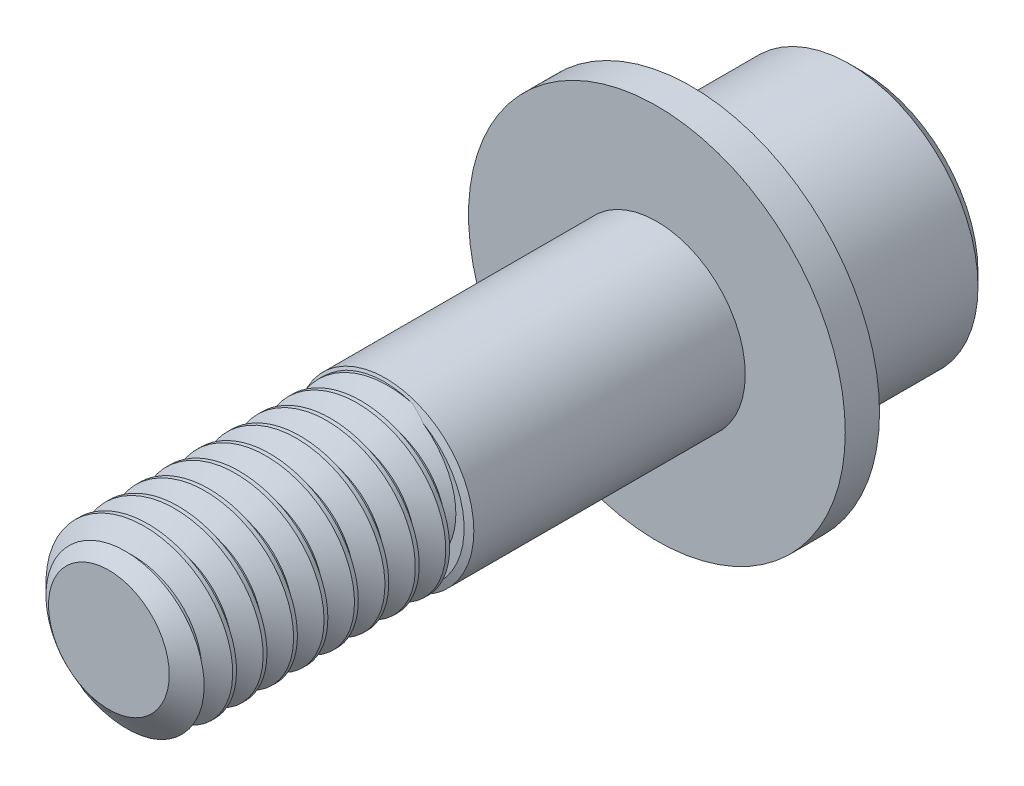
from build123d import *

# Parameters (mm, degrees)
SKETCH1_R           = 3.96875
EXTRUDE1_DEPTH      = 25.4
CUT_SWEEP1_PITCH    = 1.411111111
SKETCH6_R           = 5.953125
EXTRUDE2_DEPTH      = 9.525
SKETCH10_R          = 8.73125
BOSS_EXTRUDE1_DEPTH = 1.5875
CUT_EXTRUDE1_DEPTH  = 4.7625
CHAMFER1_SIZE       = 0.5953125
FILLET1_R           = 0.396875


with BuildPart() as part:
    # Sketch1 → Extrude1 (new body)
    with BuildSketch(Plane.XY):
        Circle(SKETCH1_R)
    extrude(amount=-EXTRUDE1_DEPTH)

    # Cut-Sweep1: the profile of Sketch3 profile screwed along a right-hand helix of 19 turns, 6 arcs to a turn; built about Z, then put on its axis
    cut_sweep1_z = Axis((0, 0, 0), (0, 0, 1))
    cut_sweep1_corners = [(3.96905, 0, -1.234895427), (3.052206448, 0, -0.705555556), (3.052206448, 0, -0.529166667), (3.96905, 0, 0.000173205)]
    with BuildLine(mode=Mode.PRIVATE) as cut_sweep1_profile:
        Line(cut_sweep1_corners[0], cut_sweep1_corners[1])
        Line(cut_sweep1_corners[1], cut_sweep1_corners[2])
        Line(cut_sweep1_corners[2], cut_sweep1_corners[3])
        Line(cut_sweep1_corners[3], cut_sweep1_corners[0])
    cut_sweep1_cap = Face(cut_sweep1_profile.wire())
    cut_sweep1_turn_angles = [0, 30, 60, 90, 120, 150, 180, 210, 240, 270, 300, 330, 360]
    cut_sweep1_turn_weights = [1, 0.8660254037844387, 1, 0.8660254037844387, 1, 0.8660254037844387, 1, 0.8660254037844387, 1, 0.8660254037844387, 1, 0.8660254037844387, 1]
    cut_sweep1_turn_rails = [Edge.make_bspline([Vector(p[0], p[1], 0).rotate(cut_sweep1_z, cut_sweep1_turn_angles[k]) / cut_sweep1_turn_weights[k] + Vector(0, 0, p[2] + CUT_SWEEP1_PITCH * cut_sweep1_turn_angles[k] / 360) for k in range(13)], [0, 0, 0, 1, 1, 2, 2, 3, 3, 4, 4, 5, 5, 6, 6, 6], 2, cut_sweep1_turn_weights) for p in cut_sweep1_corners]
    cut_sweep1_turn_sides = [Face.make_surface_from_curves(cut_sweep1_turn_rails[p[0]], cut_sweep1_turn_rails[p[1]]) for p in [(0, 1), (1, 2), (2, 3), (3, 0)]]
    cut_sweep1 = Plane(origin=(0, 0, 0), x_dir=(0, 1, 0), z_dir=(0, 0, -1)) * Solid(Shell([*[p.moved(Location((0, 0, CUT_SWEEP1_PITCH * i))) for i in range(19) for p in cut_sweep1_turn_sides], cut_sweep1_cap, cut_sweep1_cap.rotate(cut_sweep1_z, 6840).moved(Location((0, 0, CUT_SWEEP1_PITCH * 6840 / 360)))]))
    add(cut_sweep1, mode=Mode.SUBTRACT)

    # Sketch4 → Cut-Revolve1 (revolve, cut)
    with BuildSketch(Plane(origin=(0, 0, 0), x_dir=(0, 0, -1), z_dir=(1, 0, 0)), mode=Mode.PRIVATE) as cut_revolve1_sk:
        Polygon((0.819623419, 3.96875), (0, 2.798206448), (0, 3.96875), align=None)
    revolve(cut_revolve1_sk.sketch.rotate(Axis((0, 0, 0), (0, 0, -1)), 224.846133378), axis=Axis((0, 0, 0), (0, 0, -1)), mode=Mode.SUBTRACT)

    # Sketch5 → partially thread (revolve)
    with BuildSketch(Plane(origin=(0, 0, 0), x_dir=(0, 0, -1), z_dir=(1, 0, 0)), mode=Mode.PRIVATE) as partially_thread_sk:
        Polygon((25.4, 4.09575), (12.820182971, 4.09575), (12.7, 3.76555), (12.7, 0), (25.4, 0), align=None)
    revolve(partially_thread_sk.sketch.rotate(Axis((0, 0, 0), (0, 0, -1)), 284.546720109), axis=Axis((0, 0, 0), (0, 0, -1)))

    # Sketch6 → Extrude2 (add)
    with BuildSketch(Plane(origin=(0, 0, -25.4), x_dir=(-1, 0, 0), z_dir=(0, 0, -1))):
        with Locations(Location((0, 0, 0), (0, 0, 180))):
            Circle(SKETCH6_R)
    extrude(amount=EXTRUDE2_DEPTH)

    # Sketch10 → Boss-Extrude1 (add)
    with BuildSketch(Plane.XY.offset(-25.4)):
        Circle(SKETCH10_R)
    extrude(amount=-BOSS_EXTRUDE1_DEPTH)

    # Sketch7 → Cut-Extrude1 (cut)
    with BuildSketch(Plane(origin=(0, 0, -34.925), x_dir=(-1, 0, 0), z_dir=(0, 0, -1))):
        Polygon((0, 3.666174209), (-3.175, 1.833087105), (-3.175, -1.833087105), (0, -3.666174209), (3.175, -1.833087105), (3.175, 1.833087105), align=None)
    extrude(amount=-CUT_EXTRUDE1_DEPTH, mode=Mode.SUBTRACT)

    # Cut-Extrude2 cone 1 section (through the dimple's axis) → Cut-Extrude2 (revolve, cut)
    with BuildSketch(Plane(origin=(0, 0, -34.925), x_dir=(0, 1, 0), z_dir=(1, 0, 0))):
        Polygon((0, 0), (3.666174209, 0), (0, 3.666174209), align=None)
    revolve(axis=Axis((0, 0, -34.925), (0, 0, 1)), mode=Mode.SUBTRACT)

    # Chamfer1
    chamfer1_edges = [part.edges().sort_by_distance(p)[0] for p in [
        (-5.953125, 0, -34.925),
    ]]
    chamfer(chamfer1_edges, length=CHAMFER1_SIZE)

    # Fillet1
    fillet1_edges = [part.edges().sort_by_distance(p)[0] for p in [
        (-5.953125, 0, -26.9875),
    ]]
    fillet(fillet1_edges, radius=FILLET1_R)


solid = part.part
